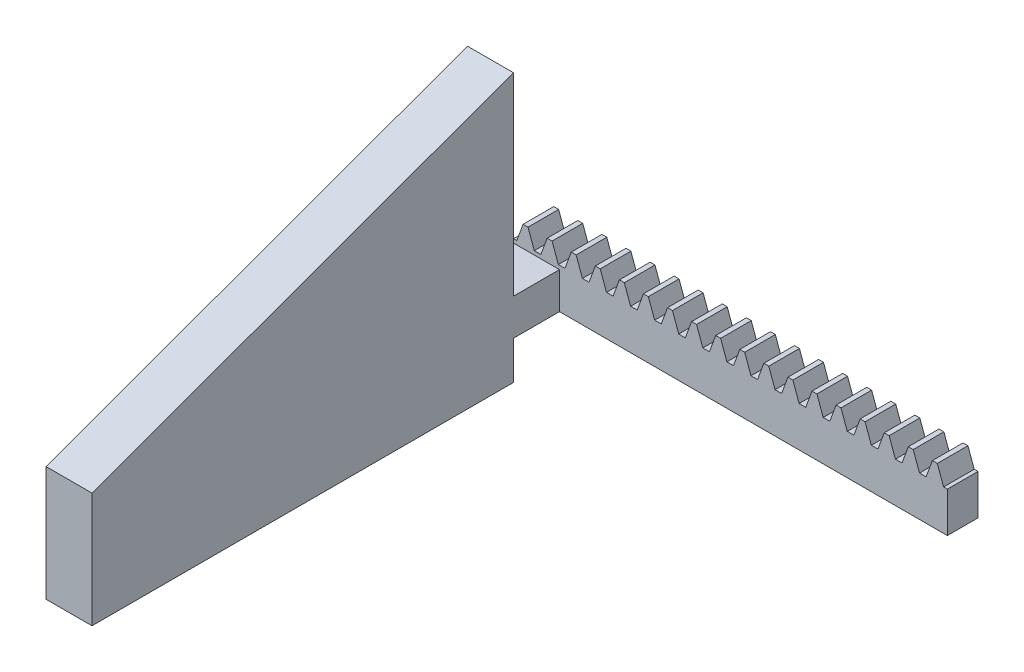
from build123d import *

# Parameters (mm, degrees)
BLANKSKE_W          = 120
BLANKSKE_H          = 16
BLANK_DEPTH         = 8
TOOTHCUTSIM_DEPTH   = 122.326007105
TEETHCUTS_COUNT     = 21
TEETHCUTS_PITCH     = 6.2831853
SKETCH1_W           = 8
SKETCH1_H           = 1
CUT_EXTRUDE1_DEPTH  = 122.326007105
BOSS_EXTRUDE2_DEPTH = 12
CUT_EXTRUDE2_DEPTH  = 188.138985783


with BuildPart() as part:
    # BlankSke → Blank (new body)
    with BuildSketch(Plane.XY):
        with Locations((60, 8)):
            Rectangle(BLANKSKE_W, BLANKSKE_H)
    extrude(amount=-BLANK_DEPTH)

    # TooCutSkeSim → ToothCutSim (cut, through all)
    with BuildSketch(Plane.XY):
        Polygon((0.861870739, 11.5), (-0.861870739, 11.5), (-2.508981637, 16.0254), (2.508981637, 16.0254), align=None)
    toothcutsim = extrude(amount=-TOOTHCUTSIM_DEPTH, mode=Mode.SUBTRACT)

    # TeethCuts: ToothCutSim ×21
    with Locations(*[(i * TEETHCUTS_PITCH, 0, 0) for i in range(1, TEETHCUTS_COUNT)]):
        add(toothcutsim, mode=Mode.SUBTRACT)

    # Sketch1 → Cut-Extrude1 (cut, through all)
    with BuildSketch(Plane(origin=(120, 0, 0), x_dir=(0, 0, -1), z_dir=(1, 0, 0))):
        with Locations((4, 0.5)):
            Rectangle(SKETCH1_W, SKETCH1_H)
    extrude(amount=-CUT_EXTRUDE1_DEPTH, mode=Mode.SUBTRACT)

    # Sketch3 → Boss-Extrude2 (add)
    with BuildSketch(Plane.ZY):
        Polygon((0, 1), (12, 1), (12, -9), (122, -9), (122, 21), (12, 61), (12, 10.5), (0, 10.5), align=None)
    extrude(amount=-BOSS_EXTRUDE2_DEPTH)

    # Sketch4 → Cut-Extrude2 (cut, through all)
    with BuildSketch(Plane(origin=(0, 0, -8), x_dir=(-1, 0, 0), z_dir=(0, 0, -1))):
        Polygon((-120, 11.5), (-118.518649961, 11.5), (-116.880783906, 16), (-115.597072194, 16), (-113.959206139, 11.5), (-113.218706139, 11.5), (-113.218706139, 1), (-120, 1), align=None)
    extrude(amount=-CUT_EXTRUDE2_DEPTH, mode=Mode.SUBTRACT)


solid = part.part
